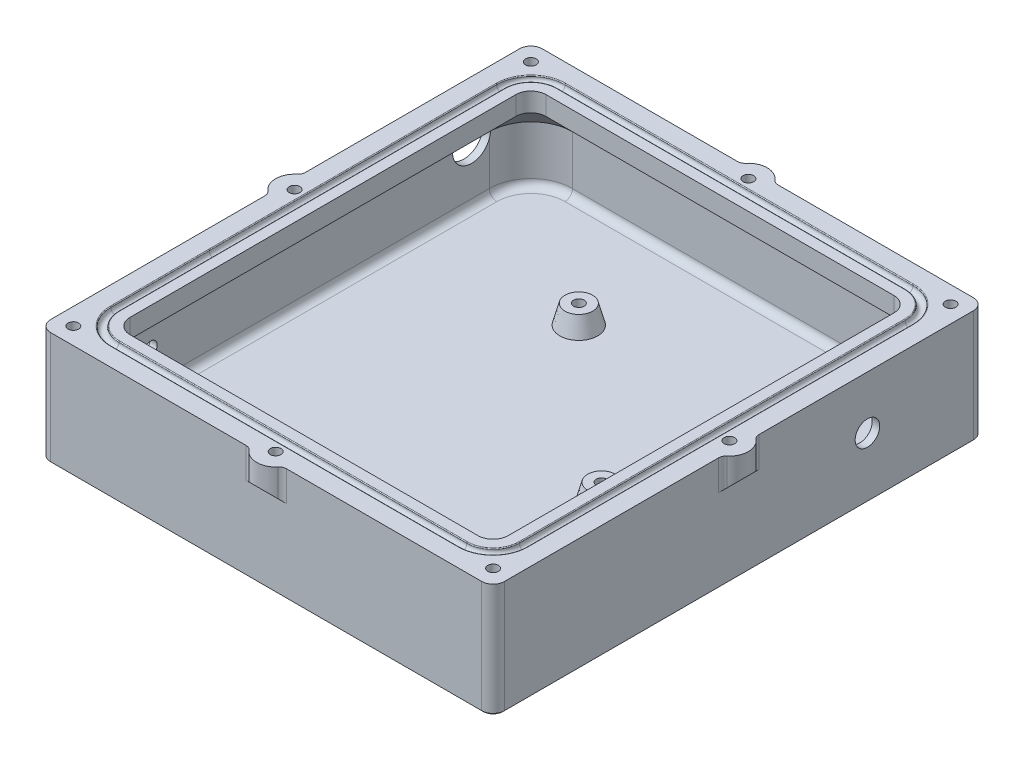
from build123d import *

# Parameters (mm, degrees)
SKETCH_1_W                = 120
SKETCH_1_H                = 130
EXTRUDE_1_DEPTH           = 2
SKETCH_2_R                = 5
EXTRUDE_2_DEPTH           = 5
EXTRUDE_2_DRAFT           = 15
EXTRUDE_2_PROFILE_2_DEPTH = 5
EXTRUDE_2_PROFILE_2_DRAFT = 15
EXTRUDE_2_PROFILE_3_DEPTH = 5
EXTRUDE_2_PROFILE_3_DRAFT = 15
SKETCH_3_R                = 1.4
CUT_EXTRUDE_1_DEPTH       = 5
SKETCH_4_W                = 120
SKETCH_4_H                = 130
SKETCH_4_W_2              = 116
SKETCH_4_H_2              = 126
EXTRUDE_3_DEPTH           = 28
SKETCH_5_W                = 116
SKETCH_5_H                = 126
SKETCH_5_W_2              = 100
SKETCH_5_H_2              = 110
EXTRUDE_4_DEPTH           = 5
SKETCH_9_R                = 3.25
CUT_EXTRUDE_4_DEPTH       = 10
SKETCH_10_R               = 1.75
CUT_EXTRUDE_5_DEPTH       = 10
FILLET_1_R                = 4
FILLET_2_R                = 11
CHAMFER_5_SIZE            = 8
SKETCH_15_R               = 1.025
FILLET_4_R                = 3
FILLET_5_R                = 2
CHAMFER_6_SIZE            = 0.4
SKETCH_16_R               = 6
CUT_EXTRUDE_7_DEPTH       = 11
SKETCH_17_R               = 1.4
CUT_EXTRUDE_8_DEPTH       = 5
EXTRUDE_5_DEPTH           = 5
CHAMFER_7_SIZE            = 3
FILLET_6_R                = 2
FILLET_7_R                = 0.2
SKETCH_19_R               = 5
CUT_EXTRUDE_9_DEPTH       = 10


with BuildPart() as part:
    # 草图1 → 凸台-拉伸1 (new body)
    with BuildSketch(Plane(origin=(0, 0, 0), x_dir=(1, 0, 0), z_dir=(0, 1, 0))):
        with Locations((60, 65)):
            Rectangle(SKETCH_1_W, SKETCH_1_H)
    extrude(amount=EXTRUDE_1_DEPTH)


with BuildPart() as extrude_2_tool:
    # 草图2 → 凸台-拉伸2 (with draft: the straight prism first)
    with BuildSketch(Plane(origin=(0, 2, 0), x_dir=(1, 0, 0), z_dir=(0, 1, 0))):
        with Locations((87.1, 61.57)):
            Circle(SKETCH_2_R)
    extrude(amount=EXTRUDE_2_DEPTH)
    # 凸台-拉伸2: the draft: its side faces are tilted about the plane it starts from
    extrude_2_sides = [extrude_2_tool.faces().sort_by_distance(p)[0] for p in [
        (82.1, 4.5, -61.57),
    ]]
    draft(extrude_2_sides, Plane(origin=(0, 2, 0), x_dir=(1, 0, 0), z_dir=(0, 1, 0)), EXTRUDE_2_DRAFT)


with BuildPart() as part_1:
    add(part.part)

    # 凸台-拉伸2: add extrude_2_tool
    add(extrude_2_tool.part)


with BuildPart() as extrude_2_profile_2_tool:
    # 草图2 → 凸台-拉伸2 profile 2 (with draft: the straight prism first)
    with BuildSketch(Plane(origin=(0, 2, 0), x_dir=(1, 0, 0), z_dir=(0, 1, 0))):
        with Locations((43.1, 99.57)):
            Circle(SKETCH_2_R)
    extrude(amount=EXTRUDE_2_PROFILE_2_DEPTH)
    # 凸台-拉伸2 profile 2: the draft: its side faces are tilted about the plane it starts from
    extrude_2_profile_2_sides = [extrude_2_profile_2_tool.faces().sort_by_distance(p)[0] for p in [
        (38.1, 4.5, -99.57),
    ]]
    draft(extrude_2_profile_2_sides, Plane(origin=(0, 2, 0), x_dir=(1, 0, 0), z_dir=(0, 1, 0)), EXTRUDE_2_PROFILE_2_DRAFT)


with BuildPart() as part_2:
    add(part_1.part)

    # 凸台-拉伸2 profile 2: add extrude_2_profile_2_tool
    add(extrude_2_profile_2_tool.part)


with BuildPart() as extrude_2_profile_3_tool:
    # 草图2 → 凸台-拉伸2 profile 3 (with draft: the straight prism first)
    with BuildSketch(Plane(origin=(0, 2, 0), x_dir=(1, 0, 0), z_dir=(0, 1, 0))):
        with Locations((28.1, 18.57)):
            Circle(SKETCH_2_R)
    extrude(amount=EXTRUDE_2_PROFILE_3_DEPTH)
    # 凸台-拉伸2 profile 3: the draft: its side faces are tilted about the plane it starts from
    extrude_2_profile_3_sides = [extrude_2_profile_3_tool.faces().sort_by_distance(p)[0] for p in [
        (23.1, 4.5, -18.57),
    ]]
    draft(extrude_2_profile_3_sides, Plane(origin=(0, 2, 0), x_dir=(1, 0, 0), z_dir=(0, 1, 0)), EXTRUDE_2_PROFILE_3_DRAFT)


with BuildPart() as part_3:
    add(part_2.part)

    # 凸台-拉伸2 profile 3: add extrude_2_profile_3_tool
    add(extrude_2_profile_3_tool.part)

    # 草图3 → 切除-拉伸1 (cut)
    with BuildSketch(Plane(origin=(0, 7, 0), x_dir=(1, 0, 0), z_dir=(0, 1, 0))):
        with Locations(Location((87.1, 61.57, 0), (0, 0, 270))):
            Circle(SKETCH_3_R)
        with Locations(Location((43.1, 99.57, 0), (0, 0, 270))):
            Circle(SKETCH_3_R)
        with Locations(Location((28.1, 18.57, 0), (0, 0, 270))):
            Circle(SKETCH_3_R)
    extrude(amount=-CUT_EXTRUDE_1_DEPTH, mode=Mode.SUBTRACT)

    # 草图4 → 凸台-拉伸3 (add)
    with BuildSketch(Plane(origin=(0, 2, 0), x_dir=(1, 0, 0), z_dir=(0, 1, 0))):
        with Locations((60, 65)):
            Rectangle(SKETCH_4_W, SKETCH_4_H)
        with Locations((60, 65)):
            Rectangle(SKETCH_4_W_2, SKETCH_4_H_2, mode=Mode.SUBTRACT)
    extrude(amount=EXTRUDE_3_DEPTH)

    # 草图5 → 凸台-拉伸4 (add)
    with BuildSketch(Plane(origin=(0, 30, 0), x_dir=(1, 0, 0), z_dir=(0, 1, 0))):
        with Locations((60, 65)):
            Rectangle(SKETCH_5_W, SKETCH_5_H)
        with Locations((60, 65)):
            Rectangle(SKETCH_5_W_2, SKETCH_5_H_2, mode=Mode.SUBTRACT)
    extrude(amount=-EXTRUDE_4_DEPTH)

    # 草图9 → 切除-拉伸4 (cut)
    with BuildSketch(Plane.ZY.offset(-118)):
        with Locations((-99, 16)):
            Circle(SKETCH_9_R)
    extrude(amount=-CUT_EXTRUDE_4_DEPTH, mode=Mode.SUBTRACT)

    # 草图10 → 切除-拉伸5 (cut)
    with BuildSketch(Plane(origin=(2, 0, 0), x_dir=(0, 0, -1), z_dir=(1, 0, 0))):
        with Locations((27.429848891, 12.10004636)):
            Circle(SKETCH_10_R)
        with Locations((22.349851397, 12.10004636)):
            Circle(SKETCH_10_R)
    extrude(amount=-CUT_EXTRUDE_5_DEPTH, mode=Mode.SUBTRACT)

    # 圆角1
    fillet_1_edges = [part_3.edges().sort_by_distance(p)[0] for p in [
        (110, 27.5, -120),
        (110, 27.5, -10),
        (10, 27.5, -10),
        (10, 27.5, -120),
    ]]
    fillet(fillet_1_edges, radius=FILLET_1_R)

    # 圆角2
    fillet_2_edges = [part_3.edges().sort_by_distance(p)[0] for p in [
        (118, 13.5, -2),
        (118, 13.5, -128),
        (2, 13.5, -2),
        (2, 13.5, -128),
    ]]
    fillet(fillet_2_edges, radius=FILLET_2_R)

    # 倒角5
    # the kernel refuses this chamfer: 8 mm, written as the material it adds along each edge
    with BuildSketch(Plane(origin=(107, 25, -128), x_dir=(0, 0.02749587661058651, 0.9996219169112968), z_dir=(-1, 0, 0)), Plane(origin=(13, 25, -2), x_dir=(0, 0.027495876610586494, -0.9996219169112968), z_dir=(1, 0, 0))) as chamfer_5_piece_1:
        Polygon((CHAMFER_5_SIZE * 0.999621916911, -CHAMFER_5_SIZE * 0.0274958766106), (-CHAMFER_5_SIZE * 0.0274958766106, -CHAMFER_5_SIZE * 0.999621916911), (0, 0), align=None)
    extrude(amount=94)
    with BuildSketch(Plane(origin=(2, 25, -117), x_dir=(0.9996219169112968, 0.027495876610586494, 0), z_dir=(0, 0, 1))) as chamfer_5_piece_2:
        Polygon((CHAMFER_5_SIZE * 0.999621916911, -CHAMFER_5_SIZE * 0.0274958766106), (-CHAMFER_5_SIZE * 0.0274958766106, -CHAMFER_5_SIZE * 0.999621916911), (0, 0), align=None)
    extrude(amount=104)
    with BuildSketch(Plane(origin=(118, 25, -13), x_dir=(-0.9996219169112968, 0.02749587661058651, 0), z_dir=(0, 0, -1))) as chamfer_5_piece_3_section:
        Polygon((CHAMFER_5_SIZE * 0.999621916911, -CHAMFER_5_SIZE * 0.0274958766106), (-CHAMFER_5_SIZE * 0.0274958766106, -CHAMFER_5_SIZE * 0.999621916911), (0, 0), align=None)
    chamfer_5_piece_3 = extrude(amount=104, mode=Mode.PRIVATE)
    chamfer_5_piece_3 = chamfer_5_piece_3 - Plane(origin=(114.666113752, 16, -99), x_dir=(0, 0, 1), z_dir=(-1, 0, 0)) * Cylinder(3.25, 240, mode=Mode.PRIVATE)
    add(chamfer_5_piece_3)
    with BuildSketch(Plane(origin=(13, 25, -13), x_dir=(0, 0, 1), z_dir=(1, 0, 0))) as chamfer_5_piece_4:
        Polygon((11 - CHAMFER_5_SIZE, 0), (11, CHAMFER_5_SIZE), (11, 0), align=None)
    revolve(axis=Axis((13, 25, -13), (0, -1, 0)), revolution_arc=90)
    with BuildSketch(Plane(origin=(107, 25, -13), x_dir=(0, 0, 1), z_dir=(-1, 0, 0))) as chamfer_5_piece_5:
        Polygon((11 - CHAMFER_5_SIZE, 0), (11, -CHAMFER_5_SIZE), (11, 0), align=None)
    revolve(axis=Axis((107, 25, -13), (0, 1, 0)), revolution_arc=90)
    with BuildSketch(Plane(origin=(107, 25, -117), x_dir=(1, 0, 0), z_dir=(0, 0, 1))) as chamfer_5_piece_6:
        Polygon((11 - CHAMFER_5_SIZE, 0), (11, -CHAMFER_5_SIZE), (11, 0), align=None)
    revolve(axis=Axis((107, 25, -117), (0, 1, 0)), revolution_arc=90)
    with BuildSketch(Plane(origin=(13, 25, -117), x_dir=(0, 0, -1), z_dir=(1, 0, 0))) as chamfer_5_piece_7:
        Polygon((11 - CHAMFER_5_SIZE, 0), (11, -CHAMFER_5_SIZE), (11, 0), align=None)
    revolve(axis=Axis((13, 25, -117), (0, 1, 0)), revolution_arc=90)

    # 切除-扫描2: sweep along a path in 草图13
    with BuildLine(Plane(origin=(0, 30, 0), x_dir=(1, 0, 0), z_dir=(0, 1, 0))) as sweep_2_path:
        Line((14, 6), (106, 6))
        ThreePointArc((106, 6), (111.656854249, 8.343145751), (114, 14))
        Line((114, 14), (114, 116))
        ThreePointArc((114, 116), (111.656854249, 121.656854249), (106, 124))
        Line((106, 124), (14, 124))
        ThreePointArc((14, 124), (8.343145751, 121.656854249), (6, 116))
        Line((6, 116), (6, 14))
        ThreePointArc((6, 14), (8.343145751, 8.343145751), (14, 6))
    # 草图15 → 切除-扫描2 (sweep, cut)
    with BuildSketch(Plane.XY.offset(-40)):
        with Locations((6, 29.6)):
            Circle(SKETCH_15_R)
    sweep(path=sweep_2_path.line, mode=Mode.SUBTRACT)

    # 圆角4
    fillet_4_edges = [part_3.edges().sort_by_distance(p)[0] for p in [
        (0, 15, -130),
        (120, 15, -130),
        (120, 15, 0),
        (0, 15, 0),
    ]]
    fillet(fillet_4_edges, radius=FILLET_4_R)

    # 圆角5
    fillet_5_edges = [part_3.edges().sort_by_distance(p)[0] for p in [
        (60, 2, -128),
        (118, 2, -65),
        (2, 2, -65),
        (60, 2, -2),
        (5.221825407, 2, -5.221825407),
        (114.778174593, 2, -5.221825407),
        (114.778174593, 2, -124.778174593),
        (5.221825407, 2, -124.778174593),
    ]]
    fillet(fillet_5_edges, radius=FILLET_5_R)

    # 倒角6
    chamfer_6_edges = [part_3.edges().sort_by_distance(p)[0] for p in [
        (0, 0, -65),
        (60, 0, -130),
        (120, 0, -65),
        (60, 0, 0),
        (119.121320344, 0, -129.121320344),
        (119.121320344, 0, -0.878679656),
        (0.878679656, 0, -0.878679656),
        (0.878679656, 0, -129.121320344),
    ]]
    chamfer(chamfer_6_edges, length=CHAMFER_6_SIZE)

    # 草图16 → 切除-拉伸7 (cut)
    with BuildSketch(Plane.ZY.offset(-118)):
        with Locations((-99, 16)):
            Circle(SKETCH_16_R)
    extrude(amount=CUT_EXTRUDE_7_DEPTH, mode=Mode.SUBTRACT)

    # 草图17 → 切除-拉伸8 (cut)
    with BuildSketch(Plane(origin=(0, 30, 0), x_dir=(1, 0, 0), z_dir=(0, 1, 0))):
        with Locations(Location((4.5, 125.5, 0), (0, 0, 270))):
            Circle(SKETCH_17_R)
        with Locations(Location((115.5, 125.5, 0), (0, 0, 270))):
            Circle(SKETCH_17_R)
        with Locations(Location((115.5, 4.5, 0), (0, 0, 270))):
            Circle(SKETCH_17_R)
        with Locations(Location((4.5, 4.5, 0), (0, 0, 270))):
            Circle(SKETCH_17_R)
        with Locations(Location((2.5, 65, 0), (0, 0, 270))):
            Circle(SKETCH_17_R)
        with Locations(Location((117.5, 65, 0), (0, 0, 270))):
            Circle(SKETCH_17_R)
        with Locations(Location((60, 127.5, 0), (0, 0, 270))):
            Circle(SKETCH_17_R)
        with Locations(Location((60, 2.5, 0), (0, 0, 270))):
            Circle(SKETCH_17_R)
    extrude(amount=-CUT_EXTRUDE_8_DEPTH, mode=Mode.SUBTRACT)

    # 草图18 → 凸台-拉伸5 (add)
    with BuildSketch(Plane(origin=(0, 30, 0), x_dir=(1, 0, 0), z_dir=(0, 1, 0))):
        with BuildLine():
            Line((55.669872981, 130), (64.330127019, 130))
            ThreePointArc((64.330127019, 130), (60, 132.5), (55.669872981, 130))
        make_face()
        with BuildLine():
            Line((120, 69.330127019), (120, 60.669872981))
            ThreePointArc((120, 60.669872981), (122.5, 65), (120, 69.330127019))
        make_face()
        with BuildLine():
            Line((55.669872981, 0), (64.330127019, 0))
            ThreePointArc((64.330127019, 0), (60, -2.5), (55.669872981, 0))
        make_face()
        with BuildLine():
            Line((0, 69.330127019), (0, 60.669872981))
            ThreePointArc((0, 60.669872981), (-2.5, 65), (0, 69.330127019))
        make_face()
    extrude(amount=-EXTRUDE_5_DEPTH)

    # 倒角7
    # the kernel refuses this chamfer: 3 mm, written as the material it adds along each edge
    with BuildSketch(Plane(origin=(47.954824017, 25, 0), x_dir=(0, -0.9996219169112968, -0.02749587661058636), z_dir=(1, 0, 0))) as chamfer_7_piece_1_section:
        Polygon((CHAMFER_7_SIZE * 0.999621916911, -CHAMFER_7_SIZE * 0.0274958766106), (-CHAMFER_7_SIZE * 0.0274958766106, -CHAMFER_7_SIZE * 0.999621916911), (0, 0), align=None)
    chamfer_7_piece_1 = extrude(amount=24.090351966, mode=Mode.PRIVATE)
    chamfer_7_piece_1 = chamfer_7_piece_1 & Plane(origin=(60, 23.891170703, -2.5), x_dir=(0.866025403784438, 0, 0.5000000000000012), z_dir=(0, 1, 0)) * Cylinder(5, 61, mode=Mode.PRIVATE)
    add(chamfer_7_piece_1)
    with BuildSketch(Plane(origin=(120, 25, -77.045175983), x_dir=(-0.027495876610586768, -0.9996219169112968, 0), z_dir=(0, 0, 1))) as chamfer_7_piece_2_section:
        Polygon((CHAMFER_7_SIZE * 0.999621916911, CHAMFER_7_SIZE * 0.0274958766106), (-CHAMFER_7_SIZE * 0.0274958766106, CHAMFER_7_SIZE * 0.999621916911), (0, 0), align=None)
    chamfer_7_piece_2 = extrude(amount=24.090351966, mode=Mode.PRIVATE)
    chamfer_7_piece_2 = chamfer_7_piece_2 & Plane(origin=(117.5, 23.891170703, -65), x_dir=(0.5000000000000018, 0, 0.8660254037844377), z_dir=(0, 1, 0)) * Cylinder(5, 61, mode=Mode.PRIVATE)
    add(chamfer_7_piece_2)
    with BuildSketch(Plane(origin=(47.954824017, 25, -130), x_dir=(0, -0.9996219169112969, 0.027495876610582164), z_dir=(1, 0, 0))) as chamfer_7_piece_3_section:
        Polygon((CHAMFER_7_SIZE * 0.999621916911, CHAMFER_7_SIZE * 0.0274958766106), (-CHAMFER_7_SIZE * 0.0274958766106, CHAMFER_7_SIZE * 0.999621916911), (0, 0), align=None)
    chamfer_7_piece_3 = extrude(amount=24.090351966, mode=Mode.PRIVATE)
    chamfer_7_piece_3 = chamfer_7_piece_3 & Plane(origin=(60, 23.891170703, -127.5), x_dir=(0.866025403784438, 0, -0.5000000000000012), z_dir=(0, 1, 0)) * Cylinder(5, 61, mode=Mode.PRIVATE)
    add(chamfer_7_piece_3)
    with BuildSketch(Plane(origin=(0, 25, -77.045175983), x_dir=(0.02749587661058636, -0.9996219169112968, 0), z_dir=(0, 0, 1))) as chamfer_7_piece_4_section:
        Polygon((CHAMFER_7_SIZE * 0.999621916911, -CHAMFER_7_SIZE * 0.0274958766106), (-CHAMFER_7_SIZE * 0.0274958766106, -CHAMFER_7_SIZE * 0.999621916911), (0, 0), align=None)
    chamfer_7_piece_4 = extrude(amount=24.090351966, mode=Mode.PRIVATE)
    chamfer_7_piece_4 = chamfer_7_piece_4 & Plane(origin=(2.5, 23.891170742, -65), x_dir=(-0.5000000000000019, 0, 0.8660254037844376), z_dir=(0, 1, 0)) * Cylinder(5, 61, mode=Mode.PRIVATE)
    add(chamfer_7_piece_4)

    # 圆角6
    fillet_6_edges = [part_3.edges().sort_by_distance(p)[0] for p in [
        (0, 27.5, -69.330127019),
        (0, 26, -60.669872981),
        (64.330127019, 26, -130),
        (55.669872981, 27.5, -130),
        (120, 26, -60.669872981),
        (120, 27.5, -69.330127019),
        (55.669872981, 27.5, 0),
        (64.330127019, 26, 0),
    ]]
    fillet(fillet_6_edges, radius=FILLET_6_R)

    # 圆角7
    fillet_7_edges = [part_3.edges().sort_by_distance(p)[0] for p in [
        (6.943729304, 30, -65),
        (9.010463141, 30, -9.010463141),
        (60, 30, -6.943729304),
        (110.989536859, 30, -9.010463141),
        (113.056270696, 30, -65),
        (110.989536859, 30, -120.989536859),
        (60, 30, -123.056270696),
        (9.010463141, 30, -120.989536859),
        (6.943729304, 30, -65),
        (5.056270696, 30, -65),
        (7.67582836, 30, -7.67582836),
        (60, 30, -5.056270696),
        (112.32417164, 30, -7.67582836),
        (114.943729304, 30, -65),
        (112.32417164, 30, -122.32417164),
        (60, 30, -124.943729304),
        (7.67582836, 30, -122.32417164),
        (5.056270696, 30, -65),
    ]]
    fillet(fillet_7_edges, radius=FILLET_7_R)

    # 草图19 → 切除-拉伸9 (cut)
    with BuildSketch(Plane.ZY):
        with Locations((-112.282662633, 17.10004636)):
            Circle(SKETCH_19_R)
    extrude(amount=-CUT_EXTRUDE_9_DEPTH, mode=Mode.SUBTRACT)


solid = part_3.part
